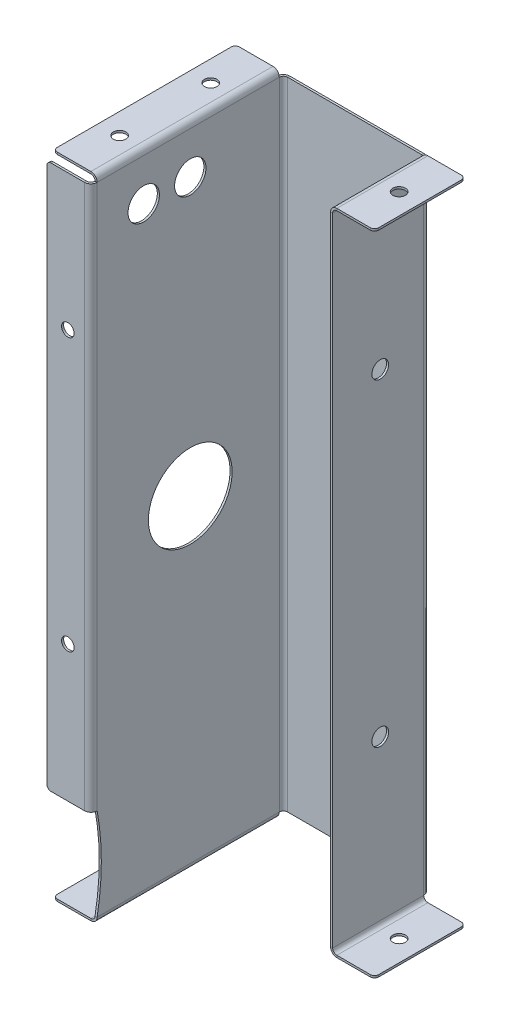
from build123d import *

# Parameters (mm, degrees)
SKETCH1_W                = 64
SKETCH1_H                = 304
SKETCH1_R                = 3
BOSS_EXTRUDE1_DEPTH      = 1
EDGE_FLANGE1_DEPTH       = 304
EDGE_FLANGE1_START       = 1
EDGE_FLANGE1_PROFILE_R   = 7.5
EDGE_FLANGE1_PROFILE_R_2 = 20
EDGE_FLANGE1_FLAT_DEPTH  = 1
EDGE_FLANGE2_DEPTH       = 260
EDGE_FLANGE2_START       = -1
EDGE_FLANGE2_PROFILE_R   = 3
EDGE_FLANGE2_FLAT_DEPTH  = 1
EDGE_FLANGE3_DEPTH       = 87
EDGE_FLANGE3_START       = -1
EDGE_FLANGE3_PROFILE_R   = 3
EDGE_FLANGE3_FLAT_DEPTH  = 1
EDGE_FLANGE4_DEPTH       = 304
EDGE_FLANGE4_START       = 1
EDGE_FLANGE4_PROFILE_W   = 304
EDGE_FLANGE4_PROFILE_H   = 43.5
EDGE_FLANGE4_PROFILE_R   = 4
EDGE_FLANGE4_FLAT_DEPTH  = 1
EDGE_FLANGE5_DEPTH       = 43.5
EDGE_FLANGE5_START       = 1
EDGE_FLANGE5_PROFILE_R   = 3
EDGE_FLANGE5_FLAT_DEPTH  = 1


# Sheet-metal steps are written as plain solids
with BuildPart() as part:
    # Sketch1 → Boss-Extrude1 (new body)
    with BuildSketch(Plane.XY):
        Rectangle(SKETCH1_W, SKETCH1_H)
        Circle(SKETCH1_R, mode=Mode.SUBTRACT)
        with Locations((0, 76)):
            Circle(SKETCH1_R, mode=Mode.SUBTRACT)
        with Locations((0, -76)):
            Circle(SKETCH1_R, mode=Mode.SUBTRACT)
    extrude(amount=BOSS_EXTRUDE1_DEPTH)

    # Edge-Flange1 bend section (across the edge) → Edge-Flange1 (add)
    with BuildSketch(Plane(origin=(-34, 152, 1), x_dir=(1, 0, 0), z_dir=(0, -1, 0))):
        with BuildLine():
            Line((-1, 2), (0, 2))
            ThreePointArc((0, 2), (0.585786438, 0.585786438), (2, 0))
            Line((2, 0), (2, -1))
            ThreePointArc((2, -1), (-0.121320344, -0.121320344), (-1, 2))
        make_face()
    extrude(amount=EDGE_FLANGE1_DEPTH)

    # Edge-Flange1 profile (on flange) → Edge-Flange1 flat (add)
    with BuildSketch(Plane(origin=(-34, 0, 1), x_dir=(0, -1, 0), z_dir=(-1, 0, 0)).offset(EDGE_FLANGE1_START)):
        with BuildLine():
            ThreePointArc((152, 89), (130, 87), (108, 89))
            Line((108, 89), (-152, 89))
            Line((-152, 89), (-152, 2))
            Line((-152, 2), (152, 2))
            Line((152, 2), (152, 89))
        make_face()
        with Locations((-132, 44.5)):
            Circle(EDGE_FLANGE1_PROFILE_R, mode=Mode.SUBTRACT)
        with Locations((0, 44.5)):
            Circle(EDGE_FLANGE1_PROFILE_R_2, mode=Mode.SUBTRACT)
        with Locations((-132, 66.75)):
            Circle(EDGE_FLANGE1_PROFILE_R, mode=Mode.SUBTRACT)
    extrude(amount=-EDGE_FLANGE1_FLAT_DEPTH)

    # Edge-Flange2 bend section (across the edge) → Edge-Flange2 (add)
    with BuildSketch(Plane(origin=(-35, -108, 92), x_dir=(0, 0, -1), z_dir=(0, 1, 0))):
        with BuildLine():
            Line((-1, 2), (0, 2))
            ThreePointArc((0, 2), (0.585786438, 0.585786438), (2, 0))
            Line((2, 0), (2, -1))
            ThreePointArc((2, -1), (-0.121320344, -0.121320344), (-1, 2))
        make_face()
    extrude(amount=EDGE_FLANGE2_DEPTH)

    # Edge-Flange2 profile (on flange) → Edge-Flange2 flat (add)
    with BuildSketch(Plane(origin=(-35, 0, 92), x_dir=(0, -1, 0), z_dir=(0, 0, -1)).offset(EDGE_FLANGE2_START)):
        with BuildLine():
            Line((-152, 2), (108, 2))
            Line((108, 2), (108, 18))
            ThreePointArc((108, 18), (107.414213562, 19.414213562), (106, 20))
            Line((106, 20), (-150, 20))
            ThreePointArc((-150, 20), (-151.414213562, 19.414213562), (-152, 18))
            Line((-152, 18), (-152, 2))
        make_face()
        with Locations((43, 10)):
            Circle(EDGE_FLANGE2_PROFILE_R, mode=Mode.SUBTRACT)
        with Locations((-87, 10)):
            Circle(EDGE_FLANGE2_PROFILE_R, mode=Mode.SUBTRACT)
    extrude(amount=EDGE_FLANGE2_FLAT_DEPTH)

    # Edge-Flange3 bend section (across the edge) → Edge-Flange3 (add)
    with BuildSketch(Plane(origin=(-35, 154, 90), x_dir=(0, -1, 0), z_dir=(0, 0, -1))):
        with BuildLine():
            Line((-1, 2), (0, 2))
            ThreePointArc((0, 2), (0.585786438, 0.585786438), (2, 0))
            Line((2, 0), (2, -1))
            ThreePointArc((2, -1), (-0.121320344, -0.121320344), (-1, 2))
        make_face()
    edge_flange3 = extrude(amount=EDGE_FLANGE3_DEPTH)

    # Edge-Flange3 profile (on flange) → Edge-Flange3 flat (add)
    with BuildSketch(Plane(origin=(-35, 154, 0), x_dir=(0, 0, 1), z_dir=(0, -1, 0)).offset(EDGE_FLANGE3_START)):
        with BuildLine():
            Line((3, 2), (90, 2))
            Line((90, 2), (90, 18))
            ThreePointArc((90, 18), (89.414213562, 19.414213562), (88, 20))
            Line((88, 20), (5, 20))
            ThreePointArc((5, 20), (3.585786438, 19.414213562), (3, 18))
            Line((3, 18), (3, 2))
        make_face()
        with Locations((24.75, 10)):
            Circle(EDGE_FLANGE3_PROFILE_R, mode=Mode.SUBTRACT)
        with Locations((68.25, 10)):
            Circle(EDGE_FLANGE3_PROFILE_R, mode=Mode.SUBTRACT)
    edge_flange3_flat = extrude(amount=EDGE_FLANGE3_FLAT_DEPTH)

    # Mirror1: Edge-Flange3, Edge-Flange3 flat across plane
    add(edge_flange3.mirror(Plane.ZX))
    add(edge_flange3_flat.mirror(Plane.ZX))

    # Edge-Flange4 bend section (across the edge) → Edge-Flange4 (add)
    with BuildSketch(Plane(origin=(34, -152, 1), x_dir=(-1, 0, 0), z_dir=(0, 1, 0))):
        with BuildLine():
            Line((-1, 2), (0, 2))
            ThreePointArc((0, 2), (0.585786438, 0.585786438), (2, 0))
            Line((2, 0), (2, -1))
            ThreePointArc((2, -1), (-0.121320344, -0.121320344), (-1, 2))
        make_face()
    extrude(amount=EDGE_FLANGE4_DEPTH)

    # Edge-Flange4 profile (on flange) → Edge-Flange4 flat (add)
    with BuildSketch(Plane(origin=(34, 0, 1), x_dir=(0, 1, 0), z_dir=(1, 0, 0)).offset(EDGE_FLANGE4_START)):
        with Locations((0, 23.75)):
            Rectangle(EDGE_FLANGE4_PROFILE_W, EDGE_FLANGE4_PROFILE_H)
        with Locations((-76, 22.75)):
            Circle(EDGE_FLANGE4_PROFILE_R, mode=Mode.SUBTRACT)
        with Locations((76, 22.75)):
            Circle(EDGE_FLANGE4_PROFILE_R, mode=Mode.SUBTRACT)
    extrude(amount=-EDGE_FLANGE4_FLAT_DEPTH)

    # Edge-Flange5 bend section (across the edge) → Edge-Flange5 (add)
    with BuildSketch(Plane(origin=(35, 154, 3), x_dir=(0, -1, 0), z_dir=(0, 0, 1))):
        with BuildLine():
            Line((-1, 2), (0, 2))
            ThreePointArc((0, 2), (0.585786438, 0.585786438), (2, 0))
            Line((2, 0), (2, -1))
            ThreePointArc((2, -1), (-0.121320344, -0.121320344), (-1, 2))
        make_face()
    edge_flange5 = extrude(amount=EDGE_FLANGE5_DEPTH)

    # Edge-Flange5 profile (on flange) → Edge-Flange5 flat (add)
    with BuildSketch(Plane(origin=(35, 154, 0), x_dir=(0, 0, 1), z_dir=(0, 1, 0)).offset(EDGE_FLANGE5_START)):
        with BuildLine():
            ThreePointArc((5, 20), (3.585786438, 19.414213562), (3, 18))
            Line((3, 18), (3, 2))
            Line((3, 2), (46.5, 2))
            Line((46.5, 2), (46.5, 18))
            ThreePointArc((46.5, 18), (45.914213562, 19.414213562), (44.5, 20))
            Line((44.5, 20), (5, 20))
        make_face()
        with Locations((24.75, 10)):
            Circle(EDGE_FLANGE5_PROFILE_R, mode=Mode.SUBTRACT)
    edge_flange5_flat = extrude(amount=-EDGE_FLANGE5_FLAT_DEPTH)

    # Mirror2: Edge-Flange5, Edge-Flange5 flat across plane
    add(edge_flange5.mirror(Plane.ZX))
    add(edge_flange5_flat.mirror(Plane.ZX))


solid = part.part
